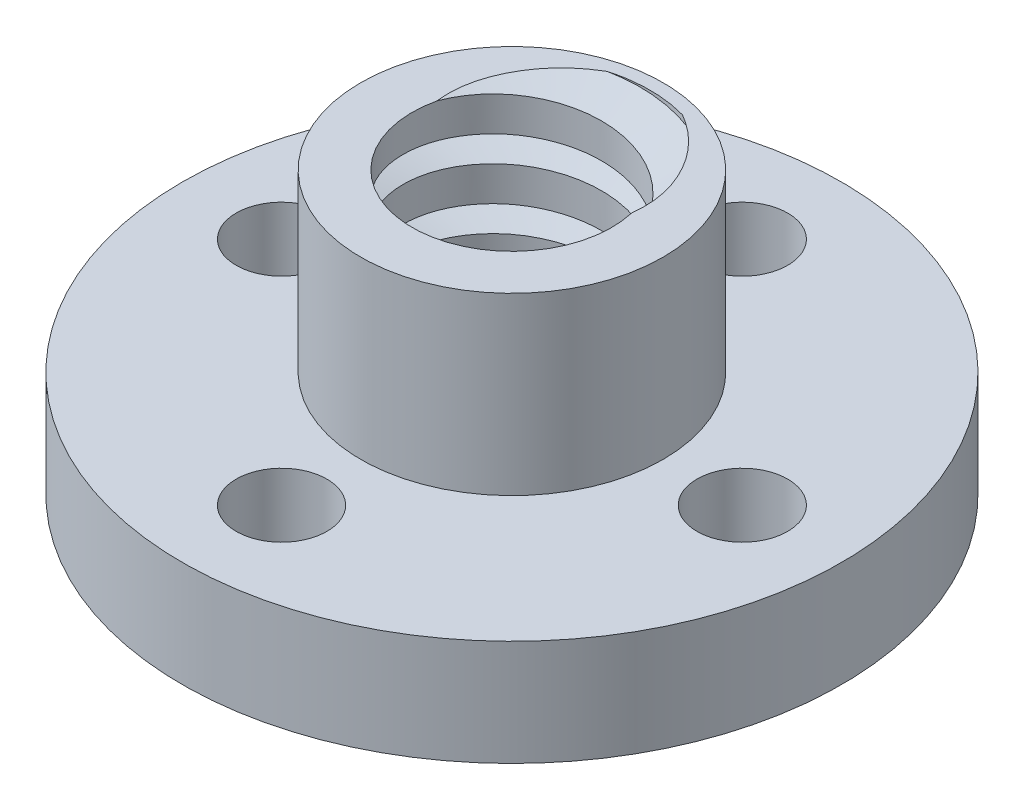
from build123d import *

# Parameters (mm, degrees)
CROQUIS3_R            = 1.5
CORTAR_EXTRUIR1_DEPTH = 17.467971587
CORTAR_BARRER1_PITCH  = 2


with BuildPart() as part:
    # Croquis1 → Revolución1 (revolve)
    with BuildSketch(Plane.XY):
        Polygon((-5, -1.205684839), (-5, 0), (-10.9, 0), (-10.9, 3.5), (-5, 3.5), (-5, 9.294315161), (-3.3, 9.294315161), (-3.3, -1.205684839), align=None)
    revolve(axis=Axis((0, -38.492405412, 0), (0, -1, 0)))

    # Croquis3 → Cortar-Extruir1 (cut, through all)
    with BuildSketch(Plane(origin=(0, 3.5, 0), x_dir=(1, 0, 0), z_dir=(0, 1, 0))):
        with Locations(Location((0, 7.62, 0), (0, 0, 180))):
            Circle(CROQUIS3_R)
        with Locations(Location((7.62, 0, 0), (0, 0, 180))):
            Circle(CROQUIS3_R)
        with Locations(Location((0, -7.62, 0), (0, 0, 180))):
            Circle(CROQUIS3_R)
        with Locations(Location((-7.62, 0, 0), (0, 0, 180))):
            Circle(CROQUIS3_R)
    extrude(amount=-CORTAR_EXTRUIR1_DEPTH, mode=Mode.SUBTRACT)

    # Cortar-Barrer1: the profile of Croquis5 screwed along a right-hand helix of 15 turns, 10 arcs to a turn; built about Z, then put on its axis
    cortar_barrer1_z = Axis((0, 0, 0), (0, 0, 1))
    cortar_barrer1_corners = [(-3.069797825, 0, 0.010237604), (-3.069797825, 0, 0.990237604), (-4.569797825, 0, 0.588313815), (-4.569797825, 0, 0.412161393)]
    with BuildLine(mode=Mode.PRIVATE) as cortar_barrer1_profile:
        Line(cortar_barrer1_corners[0], cortar_barrer1_corners[1])
        Line(cortar_barrer1_corners[1], cortar_barrer1_corners[2])
        Line(cortar_barrer1_corners[2], cortar_barrer1_corners[3])
        Line(cortar_barrer1_corners[3], cortar_barrer1_corners[0])
    cortar_barrer1_cap = Face(cortar_barrer1_profile.wire())
    cortar_barrer1_turn_angles = [0, 18, 36, 54, 72, 90, 108, 126, 144, 162, 180, 198, 216, 234, 252, 270, 288, 306, 324, 342, 360]
    cortar_barrer1_turn_weights = [1, 0.9510565162951535, 1, 0.9510565162951535, 1, 0.9510565162951535, 1, 0.9510565162951535, 1, 0.9510565162951535, 1, 0.9510565162951535, 1, 0.9510565162951535, 1, 0.9510565162951535, 1, 0.9510565162951535, 1, 0.9510565162951535, 1]
    cortar_barrer1_turn_rails = [Edge.make_bspline([Vector(p[0], p[1], 0).rotate(cortar_barrer1_z, cortar_barrer1_turn_angles[k]) / cortar_barrer1_turn_weights[k] + Vector(0, 0, p[2] + CORTAR_BARRER1_PITCH * cortar_barrer1_turn_angles[k] / 360) for k in range(21)], [0, 0, 0, 1, 1, 2, 2, 3, 3, 4, 4, 5, 5, 6, 6, 7, 7, 8, 8, 9, 9, 10, 10, 10], 2, cortar_barrer1_turn_weights) for p in cortar_barrer1_corners]
    cortar_barrer1_turn_sides = [Face.make_surface_from_curves(cortar_barrer1_turn_rails[p[0]], cortar_barrer1_turn_rails[p[1]]) for p in [(0, 1), (1, 2), (2, 3), (3, 0)]]
    cortar_barrer1 = Plane(origin=(0, 19.294315161, 0), x_dir=(-1, 0, 0), z_dir=(0, -1, 0)) * Solid(Shell([*[p.moved(Location((0, 0, CORTAR_BARRER1_PITCH * i))) for i in range(15) for p in cortar_barrer1_turn_sides], cortar_barrer1_cap, cortar_barrer1_cap.rotate(cortar_barrer1_z, 5400).moved(Location((0, 0, CORTAR_BARRER1_PITCH * 5400 / 360)))]))
    add(cortar_barrer1, mode=Mode.SUBTRACT)


solid = part.part
